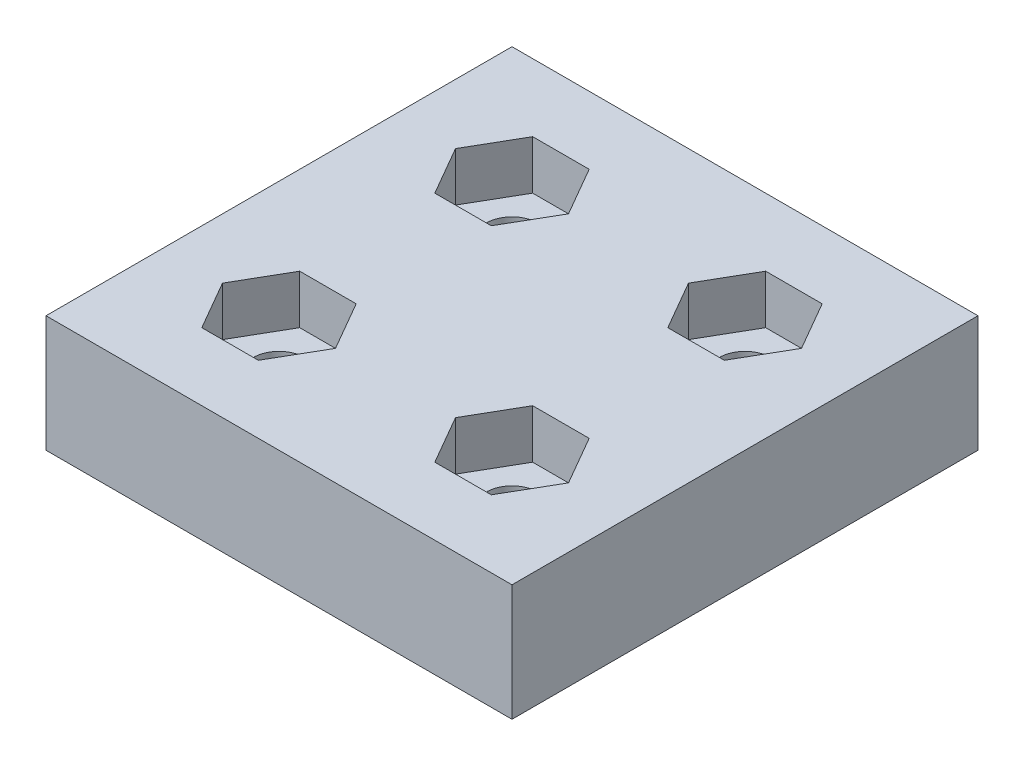
from build123d import *

# Parameters (mm, degrees)
SKETCH1_W           = 40
SKETCH1_H           = 40
SKETCH1_R           = 2.2
BOSS_EXTRUDE1_DEPTH = 10
CUT_EXTRUDE1_DEPTH  = 4.2


with BuildPart() as part:
    # Sketch1 → Boss-Extrude1 (new body)
    with BuildSketch(Plane(origin=(0, 0, 0), x_dir=(1, 0, 0), z_dir=(0, 1, 0))):
        with Locations((20, 20)):
            Rectangle(SKETCH1_W, SKETCH1_H)
        with Locations((10, 30)):
            Circle(SKETCH1_R, mode=Mode.SUBTRACT)
        with Locations((30, 30)):
            Circle(SKETCH1_R, mode=Mode.SUBTRACT)
        with Locations((30, 10)):
            Circle(SKETCH1_R, mode=Mode.SUBTRACT)
        with Locations((10, 10)):
            Circle(SKETCH1_R, mode=Mode.SUBTRACT)
    extrude(amount=BOSS_EXTRUDE1_DEPTH)

    # Sketch2 → Cut-Extrude1 (cut)
    with BuildSketch(Plane(origin=(0, 10, 0), x_dir=(1, 0, 0), z_dir=(0, 1, 0))):
        Polygon((14.849742261, 10), (12.424871131, 14.2), (7.575128869, 14.2), (5.150257739, 10), (7.575128869, 5.8), (12.424871131, 5.8), align=None)
        Polygon((25.150257739, 10), (27.575128869, 5.8), (32.424871131, 5.8), (34.849742261, 10), (32.424871131, 14.2), (27.575128869, 14.2), align=None)
        Polygon((25.150257739, 30), (27.575128869, 25.8), (32.424871131, 25.8), (34.849742261, 30), (32.424871131, 34.2), (27.575128869, 34.2), align=None)
        Polygon((14.849742261, 30), (12.424871131, 34.2), (7.575128869, 34.2), (5.150257739, 30), (7.575128869, 25.8), (12.424871131, 25.8), align=None)
    extrude(amount=-CUT_EXTRUDE1_DEPTH, mode=Mode.SUBTRACT)


solid = part.part
